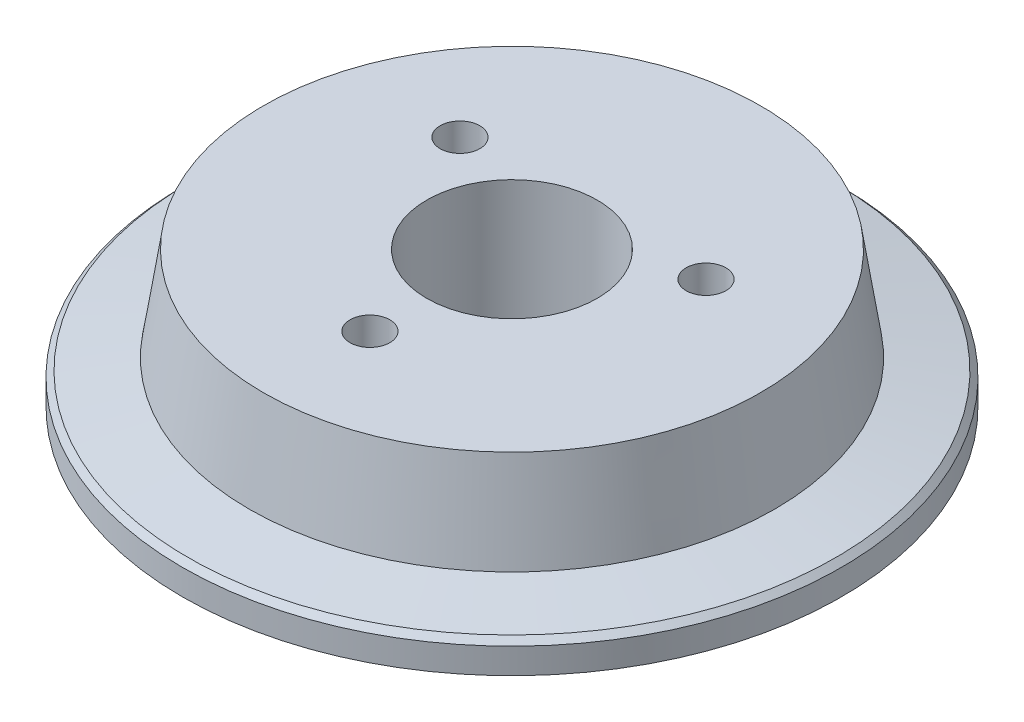
from build123d import *

# Parameters (mm, degrees)
SKETCH_4_R               = 11.6
SKETCH_4_R_2             = 1.1
EXTRUDE_1_DEPTH          = 1.1
EXTRUDE_START            = 1.5
SKETCH_4_3_R             = 9.25
SKETCH_4_3_R_2           = 1.1
EXTRUDE_2_DEPTH          = 3.3
CHAMFER_1_SIZE           = 0.2
SKETCH_6_R               = 3
CUT_EXTRUDE_1_DEPTH      = 18.092688495
SKETCH_7_R               = 0.7
CUT_EXTRUDE_2_DEPTH      = 3
PATTERN_CIRCULAR_1_COUNT = 3
CHAMFER_2_SIZE           = 3.3
CHAMFER_2_SIZE_2         = 0.5


with BuildPart() as part:
    # 草图4 → 凸台-拉伸1 (new body)
    with BuildSketch(Plane(origin=(0, 0, 0), x_dir=(1, 0, 0), z_dir=(0, 1, 0))):
        with Locations(Location((0, 0, 0), (0, 0, 270))):
            Circle(SKETCH_4_R)
        with Locations(Location((0, 0, 0), (0, 0, 270))):
            Circle(SKETCH_4_R_2, mode=Mode.SUBTRACT)
    extrude(amount=EXTRUDE_1_DEPTH)

    # 倒角1
    chamfer_1_edges = [part.edges().sort_by_distance(p)[0] for p in [
        (0, 1.1, -11.6),
    ]]
    chamfer(chamfer_1_edges, length=CHAMFER_1_SIZE)


with BuildPart() as body_2:
    # 草图4<3> → 凸台-拉伸2 (new body)
    with BuildSketch(Plane(origin=(0, 0, 0), x_dir=(1, 0, 0), z_dir=(0, 1, 0)).offset(EXTRUDE_START)):
        with Locations(Location((0, 0, 0), (0, 0, 270))):
            Circle(SKETCH_4_3_R)
        with Locations(Location((0, 0, 0), (0, 0, 270))):
            Circle(SKETCH_4_3_R_2, mode=Mode.SUBTRACT)
    extrude(amount=EXTRUDE_2_DEPTH)


    add(part.part)  # loft_1 joins it to this body
    # loft up to a face of the part (loft_1)
    loft([Face(Wire([body_2.edges().sort_by_distance((-6.742959804, 1.5, -6.33206073))[0]])), Face(Wire([body_2.edges().sort_by_distance((8.310242353, 1.1, -7.803837008))[0]]))])

    # 草图6 → 切除-拉伸1 (cut, through all)
    with BuildSketch(Plane(origin=(0, 4.8, 0), x_dir=(1, 0, 0), z_dir=(0, 1, 0))):
        with Locations(Location((0, 0, 0), (0, 0, 270))):
            Circle(SKETCH_6_R)
    extrude(amount=-CUT_EXTRUDE_1_DEPTH, mode=Mode.SUBTRACT)

    # 草图7 → 切除-拉伸2 (cut)
    with BuildSketch(Plane(origin=(0, 4.8, 0), x_dir=(1, 0, 0), z_dir=(0, 1, 0))):
        with Locations(Location((0, -5, 0), (0, 0, 270))):
            Circle(SKETCH_7_R)
    cut_extrude_2 = extrude(amount=-CUT_EXTRUDE_2_DEPTH, mode=Mode.SUBTRACT)

    # 阵列(圆周)1: 切除-拉伸2 ×3 about axis
    pattern_circular_1_axis = Axis((0, 0, 0), (0, 1, 0))
    for i in range(1, PATTERN_CIRCULAR_1_COUNT):
        add(cut_extrude_2.rotate(pattern_circular_1_axis, i * 360 / PATTERN_CIRCULAR_1_COUNT), mode=Mode.SUBTRACT)

    # 倒角2
    # the kernel refuses this chamfer: 3.3, 0.5 mm, written as the material it takes off along each edge
    with BuildSketch(Plane(origin=(0, 4.8, 0), x_dir=(0, 0, 1), z_dir=(-1, 0, 0))) as chamfer_2_piece_1:
        Polygon((9.25, -CHAMFER_2_SIZE), (9.25 - CHAMFER_2_SIZE_2, 0), (9.25, 0), align=None)
    revolve(axis=Axis((0, 4.8, 0), (0, 1, 0)), mode=Mode.SUBTRACT)


solid = body_2.part
